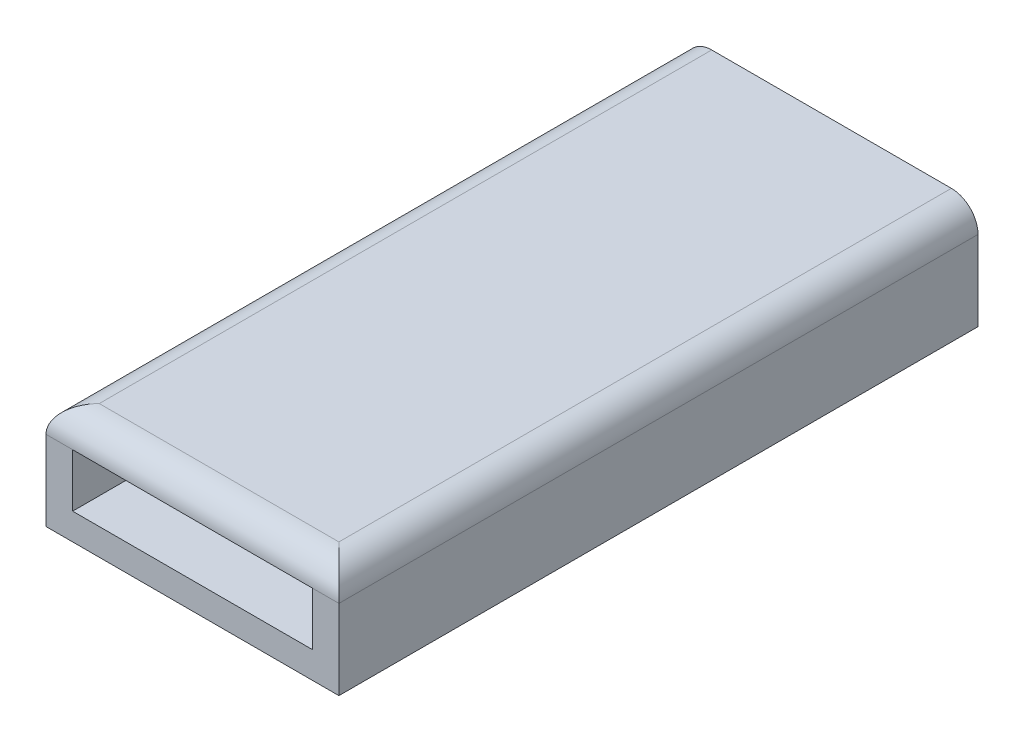
from build123d import *

# Parameters (mm, degrees)
SKETCH1_W           = 34.925
SKETCH1_H           = 12.7
BOSS_EXTRUDE1_DEPTH = 76.2
SKETCH2_W           = 28.575
SKETCH2_H           = 6.35
CUT_EXTRUDE1_DEPTH  = 74.93
FILLET1_R           = 3.175


with BuildPart() as part:
    # Sketch1 → Boss-Extrude1 (new body)
    with BuildSketch(Plane.XY):
        Rectangle(SKETCH1_W, SKETCH1_H)
    extrude(amount=BOSS_EXTRUDE1_DEPTH)

    # Sketch2 → Cut-Extrude1 (cut)
    with BuildSketch(Plane.XY.offset(76.2)):
        Rectangle(SKETCH2_W, SKETCH2_H)
    extrude(amount=-CUT_EXTRUDE1_DEPTH, mode=Mode.SUBTRACT)

    # Fillet1
    fillet1_edges = [part.edges().sort_by_distance(p)[0] for p in [
        (-17.4625, 6.35, 38.1),
        (17.4625, 6.35, 38.1),
        (0, 6.35, 76.2),
    ]]
    fillet(fillet1_edges, radius=FILLET1_R - 0.0001)  # a hair under: the kernel refuses the full size


solid = part.part
